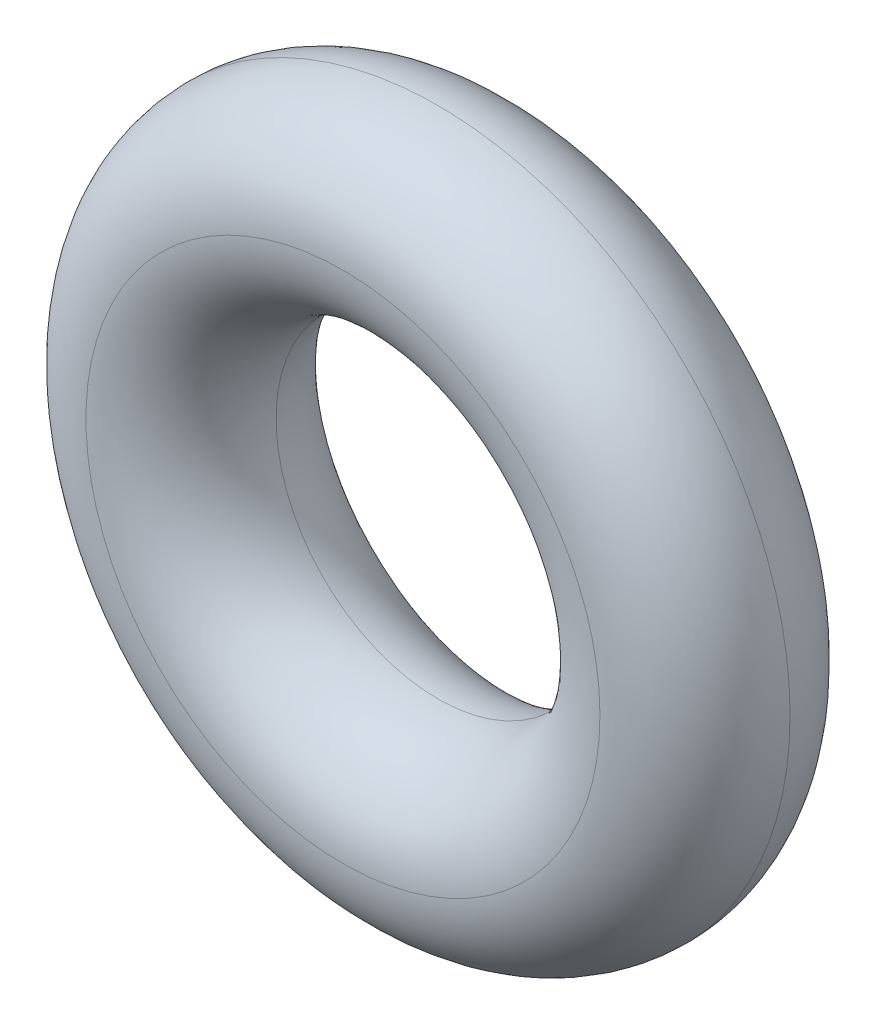
from build123d import *

# Parameters (mm, degrees)
SKETCH_1_R      = 250
SKETCH_1_R_2    = 115
EXTRUDE_1_DEPTH = 135
FILLET_1_R      = 67.5


with BuildPart() as part:
    # 草图1 → 凸台-拉伸1 (new body)
    with BuildSketch(Plane.XY):
        Circle(SKETCH_1_R)
        Circle(SKETCH_1_R_2, mode=Mode.SUBTRACT)
    extrude(amount=EXTRUDE_1_DEPTH)

    # 圆角1
    fillet_1_edges = [part.edges().sort_by_distance(p)[0] for p in [
        (-250, 0, 0),
        (-250, 0, 135),
        (-115, 0, 0),
        (-115, 0, 135),
    ]]
    fillet(fillet_1_edges, radius=FILLET_1_R - 0.0001)  # a hair under: the kernel refuses the full size


solid = part.part
